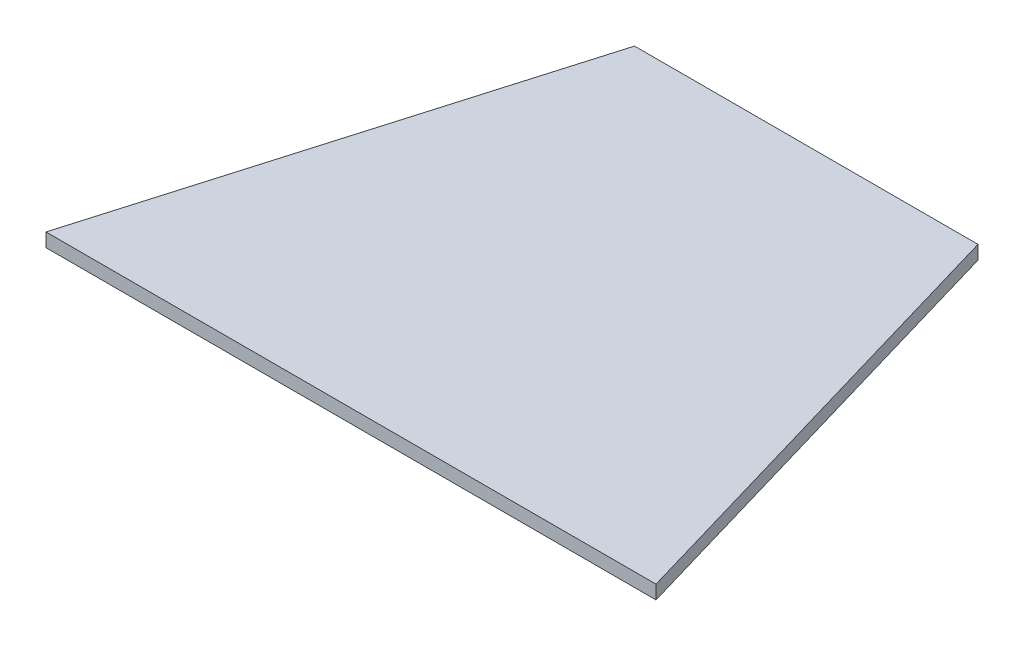
from build123d import *

# Parameters (mm, degrees)
BOSS_EXTRUDE1_DEPTH = 3


with BuildPart() as part:
    # Sketch1 → Boss-Extrude1 (new body)
    with BuildSketch(Plane(origin=(0, 0, 0), x_dir=(1, 0, 0), z_dir=(0, 1, 0))):
        Polygon((0, 0), (134, 0), (104.720058283, 100), (29.279941717, 100), align=None)
    extrude(amount=BOSS_EXTRUDE1_DEPTH)


solid = part.part
